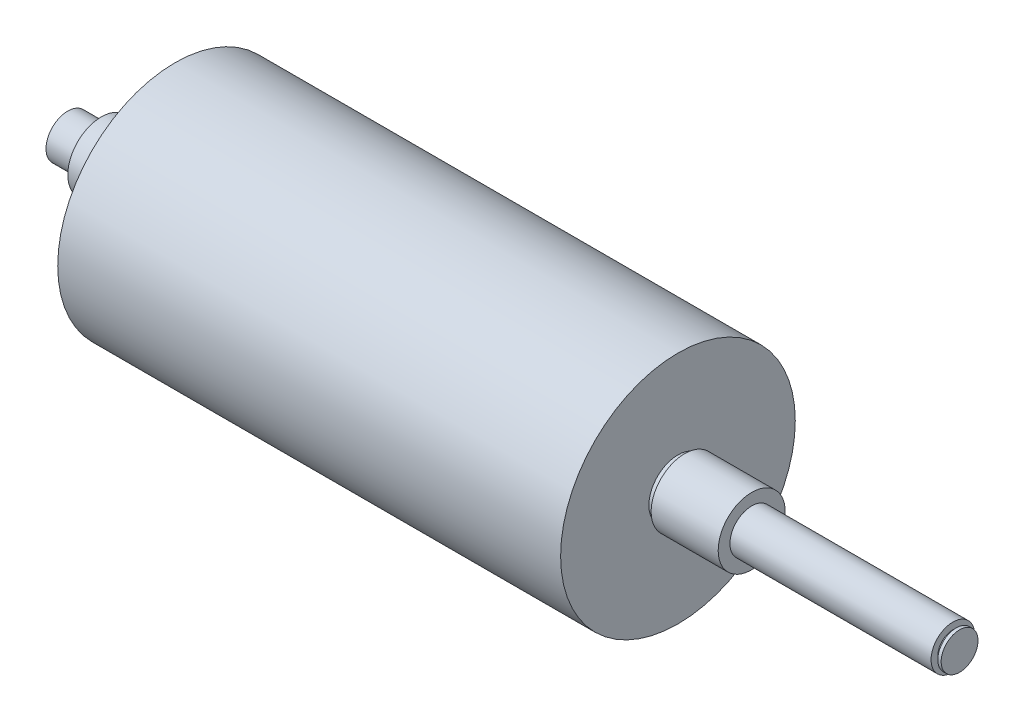
from build123d import *

# Parameters (mm, degrees)
ESQUISSE2_R             = 100
ESQUISSE2_R_2           = 65
ENL_V_MAT_EXTRU_1_DEPTH = 100
ENL_V_START             = -100
ESQUISSE3_R             = 100
ESQUISSE3_R_2           = 65
ENL_V_MAT_EXTRU_2_DEPTH = 100
ESQUISSE5_R             = 65
BOSS_EXTRU_2_DEPTH      = 520
ENL_V_START_2           = -20
ESQUISSE6_R             = 65
ESQUISSE6_R_2           = 45
ENL_V_MAT_EXTRU_3_DEPTH = 20
ESQUISSE7_R             = 55
BOSS_EXTRU_3_DEPTH      = 10


with BuildPart() as part:
    # Esquisse1 → Révolution1 (revolve)
    with BuildSketch(Plane.XY):
        Polygon((0, 100), (0, 0), (2140, 0), (2140, 100), (1840, 100), (1840, 86.721336332), (1820, 86.721336332), (1820, 350), (320, 350), (320, 74.314276715), (300, 74.314276715), (300, 100), align=None)
    revolve(axis=Axis((2140, 0, 0), (-1, 0, 0)))

    # Esquisse2 → Enlèv. mat.-Extru.1 (cut)
    with BuildSketch(Plane.ZY):
        Circle(ESQUISSE2_R)
        Circle(ESQUISSE2_R_2, mode=Mode.SUBTRACT)
    extrude(amount=-ENL_V_MAT_EXTRU_1_DEPTH, mode=Mode.SUBTRACT)

    # Esquisse3 → Enlèv. mat.-Extru.2 (cut)
    with BuildSketch(Plane(origin=(2140, 0, 0), x_dir=(0, 0, -1), z_dir=(1, 0, 0)).offset(ENL_V_START)):
        Circle(ESQUISSE3_R)
        Circle(ESQUISSE3_R_2, mode=Mode.SUBTRACT)
    extrude(amount=ENL_V_MAT_EXTRU_2_DEPTH, mode=Mode.SUBTRACT)

    # Esquisse5 → Boss.-Extru.2 (add)
    with BuildSketch(Plane(origin=(2140, 0, 0), x_dir=(0, 0, -1), z_dir=(1, 0, 0))):
        Circle(ESQUISSE5_R)
    extrude(amount=BOSS_EXTRU_2_DEPTH)

    # Esquisse6 → Enlèv. mat.-Extru.3 (cut)
    with BuildSketch(Plane(origin=(2660, 0, 0), x_dir=(0, 0, -1), z_dir=(1, 0, 0)).offset(ENL_V_START_2)):
        Circle(ESQUISSE6_R)
        Circle(ESQUISSE6_R_2, mode=Mode.SUBTRACT)
    extrude(amount=ENL_V_MAT_EXTRU_3_DEPTH, mode=Mode.SUBTRACT)

    # Esquisse7 → Boss.-Extru.3 (add)
    with BuildSketch(Plane(origin=(2660, 0, 0), x_dir=(0, 0, -1), z_dir=(1, 0, 0))):
        Circle(ESQUISSE7_R)
    extrude(amount=-BOSS_EXTRU_3_DEPTH)


solid = part.part
